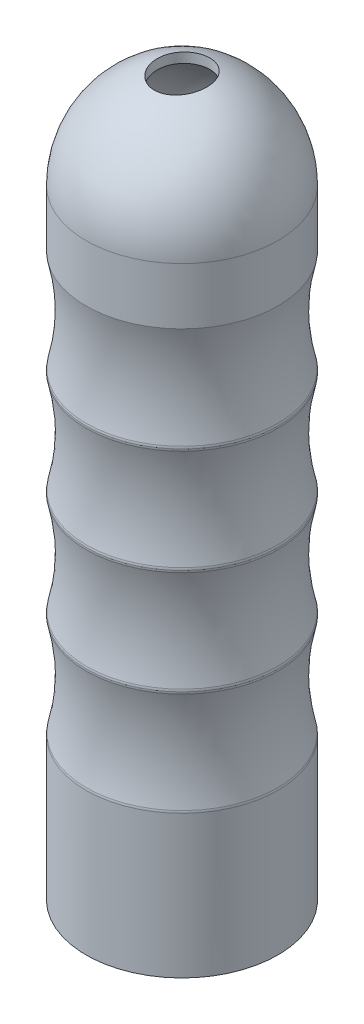
from build123d import *

# Parameters (mm, degrees)
CORTAR_EXTRUIR6_START = 40
CROQUIS3_RX           = 4.5
CROQUIS3_RY           = 4
CORTAR_EXTRUIR6_DEPTH = 143
REDONDEO5_R           = 1.5


with BuildPart() as part:
    # Croquis2 → Revolución2 (revolve)
    with BuildSketch(Plane.XY, mode=Mode.PRIVATE) as revoluci_n2_sk:
        with BuildLine():
            Line((-15.5, 100), (-15.5, 90.866072441))
            ThreePointArc((-15.5, 90.866072441), (-14.482138299, 82.547634192), (-15.5, 74.229195944))
            Line((-15.5, 74.229195944), (-15.5, 73.866072441))
            ThreePointArc((-15.5, 73.866072441), (-14.482138299, 65.547634192), (-15.5, 57.229195944))
            Line((-15.5, 57.229195944), (-15.5, 56.866072441))
            ThreePointArc((-15.5, 56.866072441), (-14.482138299, 48.547634192), (-15.5, 40.229195944))
            Line((-15.5, 40.229195944), (-15.5, 39.866072441))
            ThreePointArc((-15.5, 39.866072441), (-14.482138299, 31.547634192), (-15.5, 23.229195944))
            Line((-15.5, 23.229195944), (-15.5, 0))
            Line((-15.5, 0), (-14, 0))
            Line((-14, 0), (-14, 23.047634192))
            ThreePointArc((-14, 23.047634192), (-12.982138299, 31.547634192), (-14, 40.047634192))
            ThreePointArc((-14, 40.047634192), (-12.982138299, 48.547634192), (-14, 57.047634192))
            ThreePointArc((-14, 57.047634192), (-12.982138299, 65.547634192), (-14, 74.047634192))
            ThreePointArc((-14, 74.047634192), (-12.982138299, 82.547634192), (-14, 91.047634192))
            Line((-14, 91.047634192), (-14, 100))
            ThreePointArc((-14, 100), (-9.956223855, 110.259142264), (0, 115))
            Line((0, 115), (0, 116.496437055))
            Line((0, 116.496437055), (-0.103325416, 116.496437055))
            ThreePointArc((-0.103325416, 116.496437055), (-11.052806757, 111.28261964), (-15.5, 100))
        make_face()
    revolve(revoluci_n2_sk.sketch.rotate(Axis((0, 0, 0), (0, 1, 0)), 270), axis=Axis((0, 0, 0), (0, 1, 0)))

    # Croquis3 → Cortar-Extruir6 (cut)
    with BuildSketch(Plane(origin=(0, 0, 0), x_dir=(1, 0, 0), z_dir=(0, 1, 0)).offset(CORTAR_EXTRUIR6_START)):
        with Locations(Location((0, 0), (0, 0, -90))):
            Ellipse(CROQUIS3_RX, CROQUIS3_RY)
    extrude(amount=CORTAR_EXTRUIR6_DEPTH, mode=Mode.SUBTRACT)

    # Redondeo5
    redondeo5_edges = [part.edges().sort_by_distance(p)[0] for p in [
        (0, 74.229195944, 15.5),
        (0, 73.866072441, 15.5),
        (0, 57.229195944, 15.5),
        (0, 56.866072441, 15.5),
        (0, 40.229195944, 15.5),
        (0, 39.866072441, 15.5),
        (0, 23.229195944, 15.5),
    ]]
    fillet(redondeo5_edges, radius=REDONDEO5_R - 0.0001)  # a hair under: the kernel refuses the full size


solid = part.part
